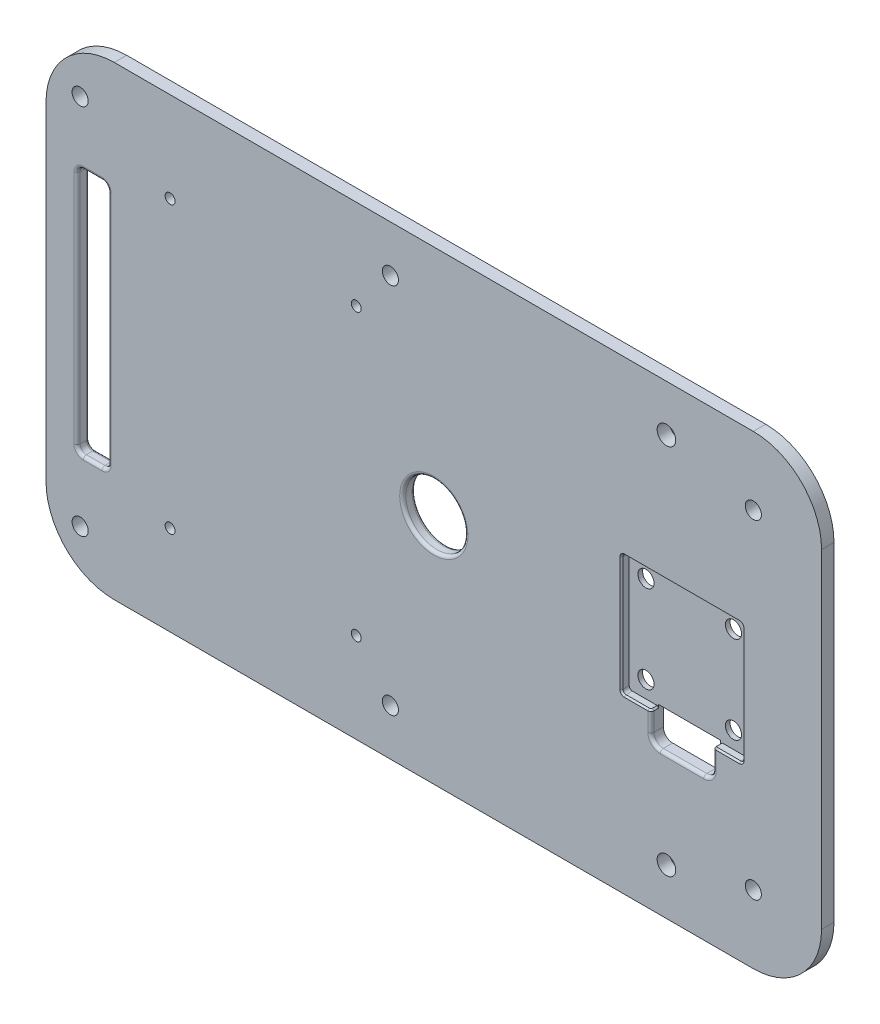
from build123d import *

# Parameters (mm, degrees)
SKETCH_1_R          = 2.6
SKETCH_1_R_2        = 1.6
SKETCH_1_R_3        = 10
SKETCH_1_R_4        = 3
SKETCH_1_W          = 20
SKETCH_1_H          = 10
EXTRUDE_1_DEPTH     = 4
SKETCH_2_W          = 39
SKETCH_2_H          = 39
CUT_EXTRUDE_1_DEPTH = 2.5
FILLET_1_R          = 3
FILLET_2_R          = 1
CHAMFER_1_SIZE      = 0.5
SKETCH_4_R          = 2.6
CUT_EXTRUDE_2_DEPTH = 2
FILLET_3_R          = 1


with BuildPart() as part:
    # 草图1 → 凸台-拉伸1 (new body)
    with BuildSketch(Plane.XY):
        with BuildLine():
            Line((-103, -75), (103, -75))
            ThreePointArc((103, -75), (118.556349186, -68.556349186), (125, -53))
            Line((125, -53), (125, 53))
            ThreePointArc((125, 53), (118.556349186, 68.556349186), (103, 75))
            Line((103, 75), (-103, 75))
            ThreePointArc((-103, 75), (-118.556349186, 68.556349186), (-125, 53))
            Line((-125, 53), (-125, -53))
            ThreePointArc((-125, -53), (-118.556349186, -68.556349186), (-103, -75))
        make_face()
        with Locations((-114, 60)):
            Circle(SKETCH_1_R, mode=Mode.SUBTRACT)
        with Locations((-114, -60)):
            Circle(SKETCH_1_R, mode=Mode.SUBTRACT)
        with Locations((-14, -60)):
            Circle(SKETCH_1_R, mode=Mode.SUBTRACT)
        with Locations((-14, 60)):
            Circle(SKETCH_1_R, mode=Mode.SUBTRACT)
        with Locations((-85, 46)):
            Circle(SKETCH_1_R_2, mode=Mode.SUBTRACT)
        with Locations((-25, 46)):
            Circle(SKETCH_1_R_2, mode=Mode.SUBTRACT)
        with Locations((-25, -46)):
            Circle(SKETCH_1_R_2, mode=Mode.SUBTRACT)
        with Locations((-85, -46)):
            Circle(SKETCH_1_R_2, mode=Mode.SUBTRACT)
        with Locations((103, 53)):
            Circle(SKETCH_1_R, mode=Mode.SUBTRACT)
        with Locations((103, -53)):
            Circle(SKETCH_1_R, mode=Mode.SUBTRACT)
        Circle(SKETCH_1_R_3, mode=Mode.SUBTRACT)
        with Locations((75, -60)):
            Circle(SKETCH_1_R_4, mode=Mode.SUBTRACT)
        with Locations((75, 60)):
            Circle(SKETCH_1_R_4, mode=Mode.SUBTRACT)
        with BuildLine():
            Line((-113, -40), (-107, -40))
            ThreePointArc((-107, -40), (-105.585786438, -39.414213562), (-105, -38))
            Line((-105, -38), (-105, 38))
            ThreePointArc((-105, 38), (-105.585786438, 39.414213562), (-107, 40))
            Line((-107, 40), (-113, 40))
            ThreePointArc((-113, 40), (-114.414213562, 39.414213562), (-115, 38))
            Line((-115, 38), (-115, -38))
            ThreePointArc((-115, -38), (-114.414213562, -39.414213562), (-113, -40))
        make_face(mode=Mode.SUBTRACT)
        with Locations((80, -24)):
            Rectangle(SKETCH_1_W, SKETCH_1_H, mode=Mode.SUBTRACT)
    extrude(amount=EXTRUDE_1_DEPTH)

    # 草图2 → 切除-拉伸1 (cut)
    with BuildSketch(Plane.XY.offset(4)):
        with Locations((80, 0)):
            Rectangle(SKETCH_2_W, SKETCH_2_H)
    extrude(amount=-CUT_EXTRUDE_1_DEPTH, mode=Mode.SUBTRACT)

    # 圆角1
    fillet_1_edges = [part.edges().sort_by_distance(p)[0] for p in [
        (70, -29, 2),
        (90, -29, 2),
    ]]
    fillet(fillet_1_edges, radius=FILLET_1_R)

    # 圆角2
    fillet_2_edges = [part.edges().sort_by_distance(p)[0] for p in [
        (80, -29, 4),
        (70.878679656, -28.121320344, 4),
        (70, -22.75, 4),
        (60.5, -19.5, 2.75),
        (99.5, -19.5, 2.75),
        (99.5, 19.5, 2.75),
        (60.5, 19.5, 2.75),
        (89.121320344, -28.121320344, 4),
        (90, -22.75, 4),
    ]]
    fillet(fillet_2_edges, radius=FILLET_2_R)

    # 倒角1
    chamfer_1_edges = [part.edges().sort_by_distance(p)[0] for p in [
        (60.792893219, -19.207106781, 4),
        (99.207106781, -19.207106781, 4),
        (99.5, 0, 4),
        (99.207106781, 19.207106781, 4),
        (80, 19.5, 4),
        (60.792893219, 19.207106781, 4),
        (60.5, 0, 4),
        (94.75, -19.5, 4),
        (90, -19.5, 2.25),
        (90.292893219, -19.5, 3.707106781),
    ]]
    chamfer(chamfer_1_edges, length=CHAMFER_1_SIZE)

    # 草图4 → 切除-拉伸2 (cut)
    with BuildSketch(Plane.XY.offset(1.5)):
        with Locations((65.900290783, -14.099709217)):
            Circle(SKETCH_4_R)
        with Locations((94.099709217, -14.099709217)):
            Circle(SKETCH_4_R)
        with Locations((94.099709217, 14.099709217)):
            Circle(SKETCH_4_R)
        with Locations((65.900290783, 14.099709217)):
            Circle(SKETCH_4_R)
    extrude(amount=-CUT_EXTRUDE_2_DEPTH, mode=Mode.SUBTRACT)

    # 圆角3
    fillet_3_edges = [part.edges().sort_by_distance(p)[0] for p in [
        (-114.414213562, 39.414213562, 0),
        (-110, 40, 0),
        (-105.585786438, 39.414213562, 0),
        (-105, 0, 0),
        (-105.585786438, -39.414213562, 0),
        (-110, -40, 0),
        (-114.414213562, -39.414213562, 0),
        (-114.414213562, 39.414213562, 4),
        (-110, 40, 4),
        (-105.585786438, 39.414213562, 4),
        (-105, 0, 4),
        (-105.585786438, -39.414213562, 4),
        (-110, -40, 4),
        (-114.414213562, -39.414213562, 4),
        (-10, 0, 0),
        (-10, 0, 4),
        (-115, 0, 0),
        (-115, 0, 4),
    ]]
    fillet(fillet_3_edges, radius=FILLET_3_R)


solid = part.part
